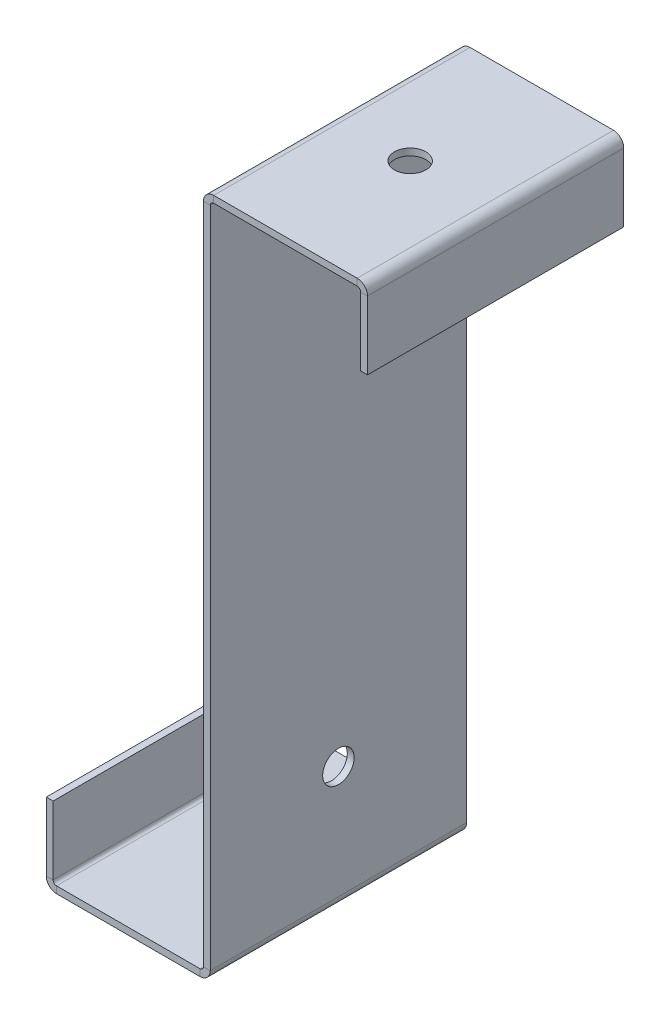
from build123d import *

# Parameters (mm, degrees)
SKETCH1_W                      = 75
SKETCH1_H                      = 200
BASE_FLANGE1_DEPTH             = 2
EDGE_FLANGE1_STRIP_W           = 10
EDGE_FLANGE1_STRIP_H           = 2
EDGE_FLANGE1_STRIP_CUT_DEPTH   = 75
EDGE_FLANGE1_STRIP_2_W         = 10
EDGE_FLANGE1_STRIP_2_H         = 2
EDGE_FLANGE1_STRIP_CUT_2_DEPTH = 75
EDGE_FLANGE1_DEPTH             = 75
EDGE_FLANGE1_BEND_DEPTH        = 75
EDGE_FLANGE2_STRIP_W           = 10
EDGE_FLANGE2_STRIP_H           = 2
EDGE_FLANGE2_STRIP_CUT_DEPTH   = 75
EDGE_FLANGE2_STRIP_2_W         = 10
EDGE_FLANGE2_STRIP_2_H         = 2
EDGE_FLANGE2_STRIP_CUT_2_DEPTH = 75
EDGE_FLANGE2_DEPTH             = 75
EDGE_FLANGE2_BEND_DEPTH        = 75
SKETCH18_R                     = 4.6
CUT_EXTRUDE1_DEPTH             = 10
SKETCH19_R                     = 4.6
CUT_EXTRUDE2_DEPTH             = 10
SKETCH20_R                     = 4.6
CUT_EXTRUDE3_DEPTH             = 10


# Sheet-metal steps are written as plain solids
with BuildPart() as part:
    # Sketch1 → Base-Flange1 (new body)
    with BuildSketch(Plane(origin=(0, 0, 0), x_dir=(0, 0, -1), z_dir=(1, 0, 0))):
        Rectangle(SKETCH1_W, SKETCH1_H)
    extrude(amount=-BASE_FLANGE1_DEPTH)

    # Edge-Flange1 strip (across the edge) → Edge-Flange1 strip cut (cut)
    with BuildSketch(Plane(origin=(0, 100, -37.5), x_dir=(0, -1, 0), z_dir=(0, 0, 1))):
        with Locations((-2, -1)):
            Rectangle(EDGE_FLANGE1_STRIP_W, EDGE_FLANGE1_STRIP_H)
    extrude(amount=EDGE_FLANGE1_STRIP_CUT_DEPTH, mode=Mode.SUBTRACT)

    # Edge-Flange1 strip 2 (across the edge) → Edge-Flange1 strip cut 2 (cut)
    with BuildSketch(Plane(origin=(-2, -100, -37.5), x_dir=(0, 1, 0), z_dir=(0, 0, 1))):
        with Locations((-2, -1)):
            Rectangle(EDGE_FLANGE1_STRIP_2_W, EDGE_FLANGE1_STRIP_2_H)
    extrude(amount=EDGE_FLANGE1_STRIP_CUT_2_DEPTH, mode=Mode.SUBTRACT)

    # Edge-Flange1 section (across the edge) → Edge-Flange1 (add)
    with BuildSketch(Plane(origin=(0, 100, -37.5), x_dir=(0, -1, 0), z_dir=(0, 0, 1))):
        with BuildLine():
            Line((0, 1), (0, 46))
            Line((0, 46), (2, 46))
            Line((2, 46), (2, 1))
            ThreePointArc((2, 1), (2.292893219, 0.292893219), (3, 0))
            Line((3, 0), (3, -2))
            ThreePointArc((3, -2), (0.878679656, -1.121320344), (0, 1))
        make_face()
    extrude(amount=EDGE_FLANGE1_DEPTH)

    # Edge-Flange1 section 2 (across the edge) → Edge-Flange1 bend (add)
    with BuildSketch(Plane(origin=(-2, -100, -37.5), x_dir=(0, 1, 0), z_dir=(0, 0, 1))):
        with BuildLine():
            Line((0, 1), (0, 46))
            Line((0, 46), (2, 46))
            Line((2, 46), (2, 1))
            ThreePointArc((2, 1), (2.292893219, 0.292893219), (3, 0))
            Line((3, 0), (3, -2))
            ThreePointArc((3, -2), (0.878679656, -1.121320344), (0, 1))
        make_face()
    extrude(amount=EDGE_FLANGE1_BEND_DEPTH)

    # Edge-Flange2 strip (across the edge) → Edge-Flange2 strip cut (cut)
    with BuildSketch(Plane(origin=(46, 98, -37.5), x_dir=(-1, 0, 0), z_dir=(0, 0, 1))):
        with Locations((-2, -1)):
            Rectangle(EDGE_FLANGE2_STRIP_W, EDGE_FLANGE2_STRIP_H)
    extrude(amount=EDGE_FLANGE2_STRIP_CUT_DEPTH, mode=Mode.SUBTRACT)

    # Edge-Flange2 strip 2 (across the edge) → Edge-Flange2 strip cut 2 (cut)
    with BuildSketch(Plane(origin=(-48, -98, -37.5), x_dir=(1, 0, 0), z_dir=(0, 0, 1))):
        with Locations((-2, -1)):
            Rectangle(EDGE_FLANGE2_STRIP_2_W, EDGE_FLANGE2_STRIP_2_H)
    extrude(amount=EDGE_FLANGE2_STRIP_CUT_2_DEPTH, mode=Mode.SUBTRACT)

    # Edge-Flange2 section (across the edge) → Edge-Flange2 (add)
    with BuildSketch(Plane(origin=(46, 98, -37.5), x_dir=(-1, 0, 0), z_dir=(0, 0, 1))):
        with BuildLine():
            Line((0, 1), (0, 21))
            Line((0, 21), (2, 21))
            Line((2, 21), (2, 1))
            ThreePointArc((2, 1), (2.292893219, 0.292893219), (3, 0))
            Line((3, 0), (3, -2))
            ThreePointArc((3, -2), (0.878679656, -1.121320344), (0, 1))
        make_face()
    extrude(amount=EDGE_FLANGE2_DEPTH)

    # Edge-Flange2 section 2 (across the edge) → Edge-Flange2 bend (add)
    with BuildSketch(Plane(origin=(-48, -98, -37.5), x_dir=(1, 0, 0), z_dir=(0, 0, 1))):
        with BuildLine():
            Line((0, 1), (0, 21))
            Line((0, 21), (2, 21))
            Line((2, 21), (2, 1))
            ThreePointArc((2, 1), (2.292893219, 0.292893219), (3, 0))
            Line((3, 0), (3, -2))
            ThreePointArc((3, -2), (0.878679656, -1.121320344), (0, 1))
        make_face()
    extrude(amount=EDGE_FLANGE2_BEND_DEPTH)

    # Sketch18 → Cut-Extrude1 (cut)
    with BuildSketch(Plane(origin=(0, 100, 0), x_dir=(1, 0, 0), z_dir=(0, 1, 0))):
        with Locations(Location((21, 0, 0), (0, 0, 180))):
            Circle(SKETCH18_R)
    extrude(amount=-CUT_EXTRUDE1_DEPTH, mode=Mode.SUBTRACT)

    # Sketch19 → Cut-Extrude2 (cut)
    with BuildSketch(Plane(origin=(0, -98, 0), x_dir=(1, 0, 0), z_dir=(0, 1, 0))):
        with Locations(Location((-23, 0, 0), (0, 0, 180))):
            Circle(SKETCH19_R)
    extrude(amount=-CUT_EXTRUDE2_DEPTH, mode=Mode.SUBTRACT)

    # Sketch20 → Cut-Extrude3 (cut)
    with BuildSketch(Plane(origin=(0, 0, 0), x_dir=(0, 0, -1), z_dir=(1, 0, 0))):
        with Locations((0, -64)):
            Circle(SKETCH20_R)
    extrude(amount=-CUT_EXTRUDE3_DEPTH, mode=Mode.SUBTRACT)


solid = part.part
